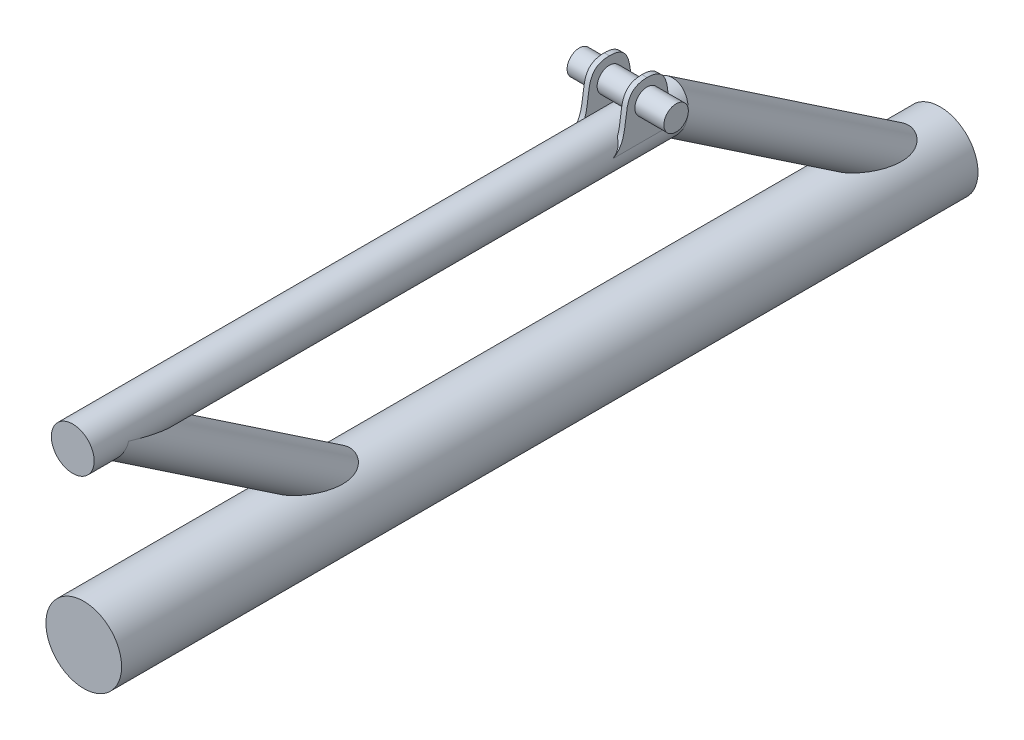
from build123d import *

# Parameters (mm, degrees)
SKETCH1_R                = 25.8
BOSS_EXTRUDE1_DEPTH      = 544
SKETCH6_R                = 14.6
BOSS_EXTRUDE2_REACH      = 541.822
BOSS_EXTRUDE2_END_RADIUS = 25.8
SKETCH4_R                = 14.6
BOSS_EXTRUDE3_START      = -3.5
BOSS_EXTRUDE3_OUTLINE_R  = 8.35
BOSS_EXTRUDE3_DEPTH      = 3.5
BOSS_EXTRUDE4_START      = 17
SKETCH7_3_R              = 8.35
BOSS_EXTRUDE4_DEPTH      = 66
SKETCH9_R                = 25.8
BOSS_EXTRUDE5_DEPTH      = 16.49
BOSS_EXTRUDE6_START      = 23.51
SKETCH10_R               = 25.8
BOSS_EXTRUDE6_DEPTH      = 23.51
BOSS_EXTRUDE7_START      = 4.5
SKETCH11_R               = 14.6
BOSS_EXTRUDE7_DEPTH      = 4.5


# Read off the part's stored shape, not the designer's step: Boss-Extrude3
with BuildPart() as part:
    # Sketch1 → Boss-Extrude1 (new body)
    with BuildSketch(Plane.XY):
        Circle(SKETCH1_R)
    extrude(amount=-BOSS_EXTRUDE1_DEPTH)

    # Sweep2: sweep along a path in Sketch2
    with BuildLine(Plane(origin=(0, 0, 0), x_dir=(0, 0, -1), z_dir=(1, 0, 0))) as sweep2_path:
        Line((535.242725219, 10.616416132), (373.485286901, 119.6))
        Line((373.485286901, 119.6), (-26.514713099, 119.6))
    # Sketch6 → Sweep2 (sweep)
    with BuildSketch(Plane(origin=(0, 10.616416132, -535.242725219), x_dir=(1, 0, 0), z_dir=(0, 0.5587587437797145, 0.8293302516185669))):
        Circle(SKETCH6_R)
    sweep(path=sweep2_path.line, transition=Transition.RIGHT)

    # Boss-Extrude2: up to this cylinder (the profile starts outside it)
    boss_extrude2_end = Plane(origin=(0, 0, 7.489761), z_dir=(0, 0, 1)) * Cylinder(BOSS_EXTRUDE2_END_RADIUS, 1136.244, mode=Mode.PRIVATE)
    # Sketch4 → Boss-Extrude2 (add, up to the surface)
    with BuildSketch(Plane(origin=(0, 296.142134203, -111.454966642), x_dir=(1, 0, 0), z_dir=(0, 0.5587587437797145, 0.8293302516185669)), mode=Mode.PRIVATE) as boss_extrude2_sk1:
        with Locations(Location((0, -212.87313933, 0), (0, 0, 270))):
            Circle(SKETCH4_R)
    boss_extrude2_tool1 = extrude(boss_extrude2_sk1.sketch, amount=-BOSS_EXTRUDE2_REACH, mode=Mode.PRIVATE) - boss_extrude2_end
    add(boss_extrude2_tool1.solids().sort_by_distance((0, 119.6, 7.489761))[0])

    # Boss-Extrude3 outline → Boss-Extrude3 (add)
    with BuildSketch(Plane.ZY.offset(14.6).offset(BOSS_EXTRUDE3_START)):
        with BuildLine():
            add(Edge.make_bspline(
                [(-369.025798161, 121.314868638), (-354.153662916, 130.263805611), (-368.24558028, 157.483504956), (-346.0257981, 157.599948143)],
                knots=[0, 0, 0, 0, 0.999846057, 0.999846057, 0.999846057, 0.999846057], degree=3))
            Line((-369.025798161, 121.314868638), (-323.025798161, 121.314868638))
            add(Edge.make_bspline(
                [(-323.025798161, 121.314868638), (-337.897933379, 130.263805595), (-323.806016093, 157.483504857), (-346.0257981, 157.599948143)],
                knots=[0, 0, 0, 0, 0.999846056, 0.999846056, 0.999846056, 0.999846056], degree=3))
        make_face()
        with Locations((-346.025798161, 143.65)):
            Circle(BOSS_EXTRUDE3_OUTLINE_R, mode=Mode.SUBTRACT)
    boss_extrude3 = extrude(amount=BOSS_EXTRUDE3_DEPTH)

    # Mirror1: Boss-Extrude3 across plane
    add(boss_extrude3.mirror(Plane.ZY))

    # Sketch7<3> → Boss-Extrude4 (add)
    with BuildSketch(Plane.ZY.offset(14.6).offset(BOSS_EXTRUDE4_START)):
        with Locations((-346.025798161, 143.65)):
            Circle(SKETCH7_3_R)
    extrude(amount=-BOSS_EXTRUDE4_DEPTH)

    # Sketch9 → Boss-Extrude5 (add)
    with BuildSketch(Plane(origin=(0, 0, -544), x_dir=(-1, 0, 0), z_dir=(0, 0, -1))):
        with Locations(Location((0, 0, 0), (0, 0, 180))):
            Circle(SKETCH9_R)
    extrude(amount=BOSS_EXTRUDE5_DEPTH)

    # Sketch10 → Boss-Extrude6 (add)
    with BuildSketch(Plane.XY.offset(BOSS_EXTRUDE6_START)):
        Circle(SKETCH10_R)
    extrude(amount=-BOSS_EXTRUDE6_DEPTH)

    # Sketch11 → Boss-Extrude7 (add)
    with BuildSketch(Plane.XY.offset(26.514713099).offset(BOSS_EXTRUDE7_START)):
        with Locations((0, 119.6)):
            Circle(SKETCH11_R)
    extrude(amount=-BOSS_EXTRUDE7_DEPTH)


solid = part.part
